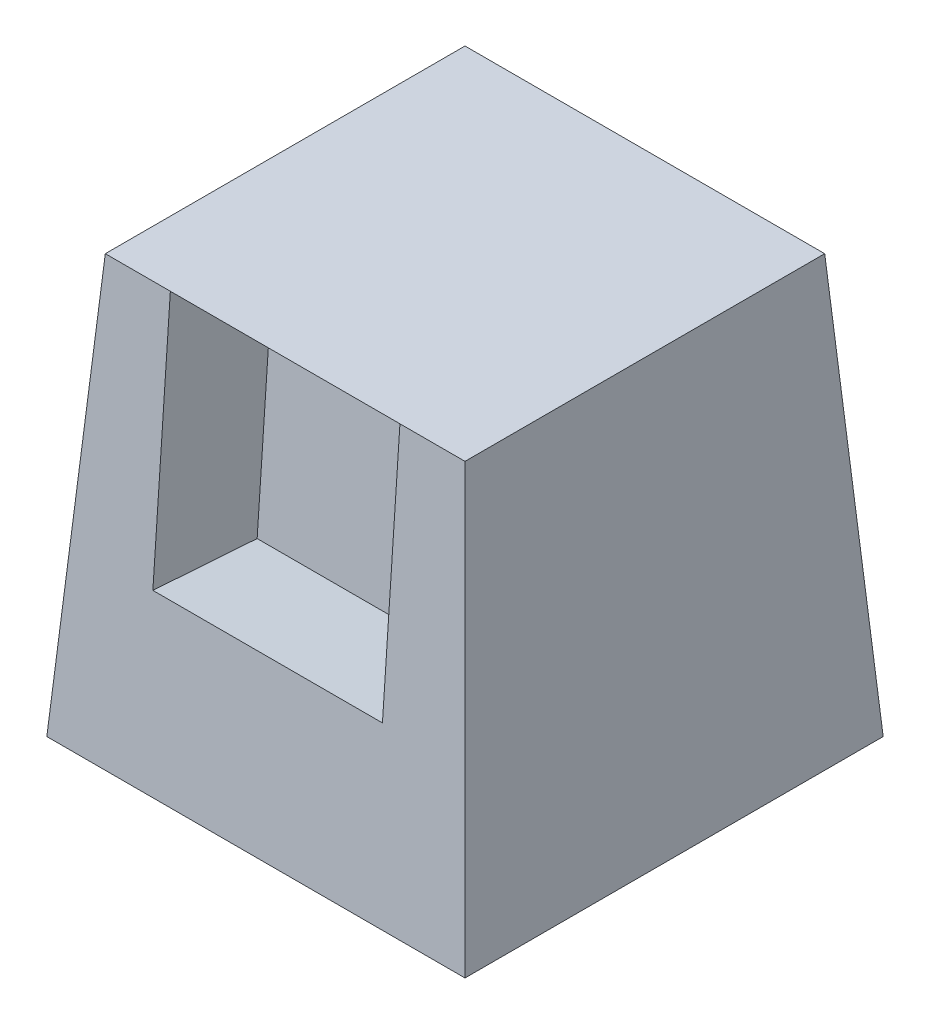
from build123d import *

# Parameters (mm, degrees)
SKETCH1_W           = 200
SKETCH1_H           = 200
BOSS_EXTRUDE1_DEPTH = 200
BOSS_EXTRUDE1_TAPER = 4
SKETCH7_W           = 109.8
SKETCH7_H           = 120
CUT_EXTRUDE2_DEPTH  = 50


with BuildPart() as part:
    # Sketch1 → Boss-Extrude1 (new body)
    with BuildSketch(Plane(origin=(0, 0, 0), x_dir=(1, 0, 0), z_dir=(0, 1, 0))):
        Rectangle(SKETCH1_W, SKETCH1_H)
    extrude(amount=BOSS_EXTRUDE1_DEPTH, taper=BOSS_EXTRUDE1_TAPER)

    # Sketch7 → Cut-Extrude2 (cut)
    with BuildSketch(Plane(origin=(0, 6.958655048, 99.513403437), x_dir=(1, 0, 0), z_dir=(0, 0.0697564737441254, 0.9975640502598242))):
        with Locations((0, 133.512732242)):
            Rectangle(SKETCH7_W, SKETCH7_H)
    extrude(amount=-CUT_EXTRUDE2_DEPTH, mode=Mode.SUBTRACT)


solid = part.part
